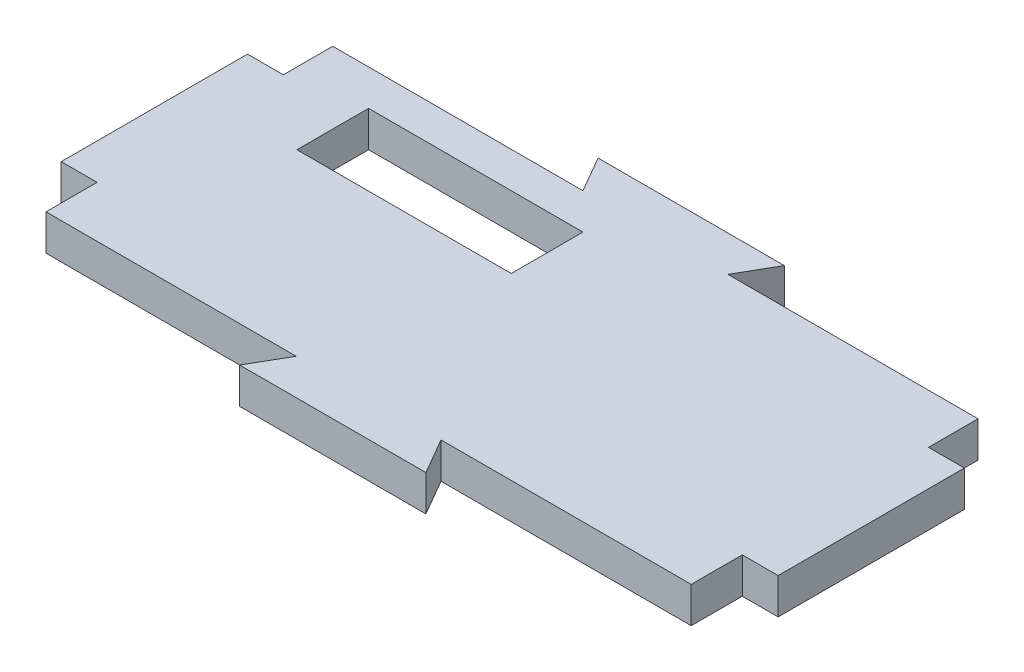
from build123d import *

# Parameters (mm, degrees)
BOSS_EXTRUDE1_DEPTH     = 5
CUT_EXTRUDE1_DEPTH      = 57.124860802
CUT_EXTRUDE1_DEPTH_BACK = 57.124860802
SKETCH3_W               = 29.896370289
SKETCH3_H               = 10


with BuildPart() as part:
    # Sketch2 → Boss-Extrude1 (new body)
    with BuildSketch(Plane(origin=(0, 0, 0), x_dir=(-1, 0, 0), z_dir=(0, 1, 0))):
        Polygon((-45, -13.103802672), (-45, -20), (-10.103629711, -20), (-12.990381057, -25), (12.990381057, -25), (10.103629711, -20), (45, -20), (45, -13.103802672), (50, -13.103802672), (50, 12.876959441), (45, 12.876959441), (45, 20), (10.103629711, 20), (12.990381057, 25), (-12.990381057, 25), (-10.103629711, 20), (-45, 20), (-45, 12.876959441), (-50, 12.876959441), (-50, -13.103802672), align=None)
    extrude(amount=BOSS_EXTRUDE1_DEPTH)

    # Sketch3 → Cut-Extrude1 (cut, two sides: drawn at the far end of the back side and taken through both)
    with BuildSketch(Plane(origin=(0, 5, 0), x_dir=(-1, 0, 0), z_dir=(0, 1, 0)).offset(-CUT_EXTRUDE1_DEPTH_BACK)):
        with Locations((20.051814855, -10)):
            Rectangle(SKETCH3_W, SKETCH3_H)
    extrude(amount=CUT_EXTRUDE1_DEPTH + CUT_EXTRUDE1_DEPTH_BACK, mode=Mode.SUBTRACT)


solid = part.part
